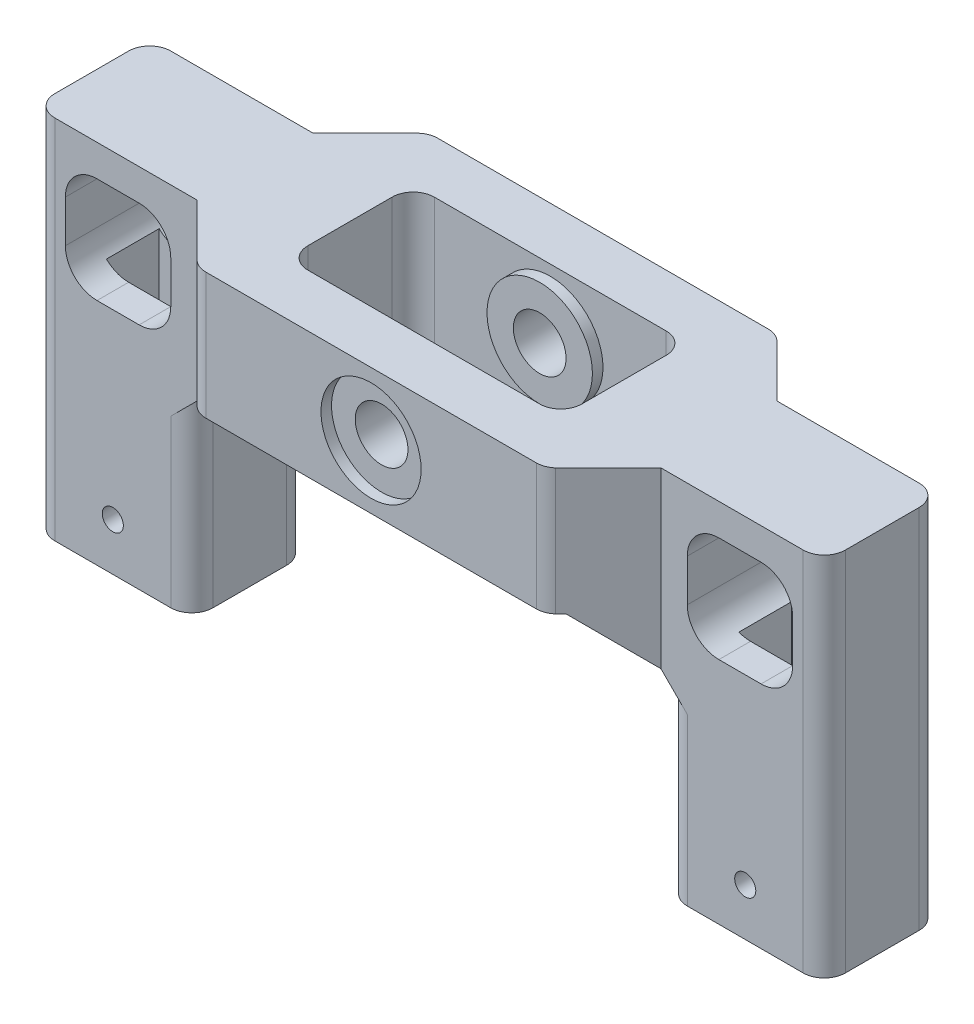
from build123d import *

# Parameters (mm, degrees)
EXTRUDE_1_DEPTH        = 5.5
EXTRUDE_1_DEPTH_BACK   = 5.5
SKETCH_1_W             = 15
SKETCH_1_H             = 24.5
EXTRUDE_1_2_DEPTH      = 5.5
EXTRUDE_1_2_DEPTH_BACK = 5.5
SKETCH_2_W             = 7.2
SKETCH_2_H             = 5
CUT_EXTRUDE_1_DEPTH    = 62
SKETCH_3_W             = 26
SKETCH_3_H             = 12
EXTRUDE_2_DEPTH        = 12
SKETCH_4_R             = 2.5
CUT_EXTRUDE_2_DEPTH    = 90
CHAMFER_2_SIZE         = 5
FILLET_2_R             = 2
SKETCH_14_W            = 15
SKETCH_14_H            = 11
SKETCH_14_W_2          = 7.2
SKETCH_14_H_2          = 5
EXTRUDE_5_DEPTH        = 10.25
SKETCH_7_R             = 1
CUT_EXTRUDE_3_DEPTH    = 34
EXTRUDE_START          = 1
SKETCH_13_R            = 5
SKETCH_13_R_2          = 2.5
EXTRUDE_4_DEPTH        = 1
CHAMFER_3_SIZE         = 5
SKETCH_19_W            = 10
SKETCH_19_H            = 10
CUT_EXTRUDE_4_DEPTH    = 31.2
SKETCH_17_R            = 4.75
SKETCH_17_R_2          = 2.5
CUT_EXTRUDE_5_DEPTH    = 1
SKETCH_20_W            = 7.2
SKETCH_20_H            = 3
EXTRUDE_6_DEPTH        = 5
FILLET_6_R             = 3
FILLET_7_R             = 2


with BuildPart() as part:
    # 草图1 → 凸台-拉伸1 (new, two sides: drawn at the far end of the back side and taken through both)
    with BuildSketch(Plane.XY.offset(-EXTRUDE_1_DEPTH_BACK)):
        with Locations((30, 0)):
            Rectangle(SKETCH_1_W, SKETCH_1_H)
    extrude(amount=EXTRUDE_1_DEPTH + EXTRUDE_1_DEPTH_BACK)


with BuildPart() as body_2:
    # 草图1 → Extrude 1 2 (new, two sides: drawn at the far end of the back side and taken through both)
    with BuildSketch(Plane.XY.offset(-EXTRUDE_1_2_DEPTH_BACK)):
        with Locations((-30, 0)):
            Rectangle(SKETCH_1_W, SKETCH_1_H)
    extrude(amount=EXTRUDE_1_2_DEPTH + EXTRUDE_1_2_DEPTH_BACK)


with BuildPart() as cut_extrude_1_tool:
    # 草图2 → 切除-拉伸1 (new body)
    with BuildSketch(Plane(origin=(0, 12.25, 0), x_dir=(1, 0, 0), z_dir=(0, 1, 0))):
        with Locations((30, 0)):
            Rectangle(SKETCH_2_W, SKETCH_2_H)
        with Locations((-30, 0)):
            Rectangle(SKETCH_2_W, SKETCH_2_H)
    extrude(amount=-CUT_EXTRUDE_1_DEPTH)


with BuildPart() as part_1:
    add(part.part)

    # 切除-拉伸1: cut by cut_extrude_1_tool
    add(cut_extrude_1_tool.part, mode=Mode.SUBTRACT)



with BuildPart() as body_2_1:
    add(body_2.part)

    # 切除-拉伸1: cut by cut_extrude_1_tool
    add(cut_extrude_1_tool.part, mode=Mode.SUBTRACT)


with BuildPart() as part_2:
    add(part_1.part)

    add(body_2_1.part)  # 凸台-拉伸2 merges body 2
    # 草图3 → 凸台-拉伸2 (add)
    with BuildSketch(Plane(origin=(0, 12.25, 0), x_dir=(1, 0, 0), z_dir=(0, 1, 0))):
        Polygon((22.5, 5.5), (17, 5.5), (17, 11), (-17, 11), (-17, 5.5), (-22.5, 5.5), (-22.5, -5.5), (-17, -5.5), (-17, -11), (17, -11), (17, -5.5), (22.5, -5.5), align=None)
        Rectangle(SKETCH_3_W, SKETCH_3_H, mode=Mode.SUBTRACT)
    extrude(amount=-EXTRUDE_2_DEPTH)

    # 草图4 → 切除-拉伸2 (cut)
    with BuildSketch(Plane.XY.offset(11)):
        with Locations((0, 6.25)):
            Circle(SKETCH_4_R)
    extrude(amount=-CUT_EXTRUDE_2_DEPTH, mode=Mode.SUBTRACT)

    # 倒角2
    chamfer_2_edges = [part_2.edges().sort_by_distance(p)[0] for p in [
        (17, 6.25, 5.5),
        (-17, 6.25, 5.5),
        (-17, 6.25, -5.5),
        (17, 6.25, -5.5),
    ]]
    chamfer(chamfer_2_edges, length=CHAMFER_2_SIZE)

    # 圆角2
    # the kernel refuses this fillet: 2 mm, written as the material it adds along each edge
    with BuildSketch(Plane(origin=(-13, 12.25, 6), x_dir=(0, 0, -1), z_dir=(0, -1, 0)), Plane(origin=(13, 12.25, 6), x_dir=(-1, 0, 0), z_dir=(0, -1, 0)), Plane(origin=(13, 12.25, -6), x_dir=(0, 0, 1), z_dir=(0, -1, 0))) as fillet_2_piece_1:
        with BuildLine():
            CenterArc((FILLET_2_R, FILLET_2_R), FILLET_2_R, 180, 90)
            Line((0, FILLET_2_R), (0, 0))
            Line((0, 0), (FILLET_2_R, 0))
        make_face()
    extrude(amount=12)
    with BuildSketch(Plane(origin=(-13, 12.25, -6), x_dir=(0, 0, 1), z_dir=(0, -1, 0))) as fillet_2_piece_2:
        with BuildLine():
            CenterArc((FILLET_2_R, -FILLET_2_R), FILLET_2_R, 90, 90)
            Line((0, -FILLET_2_R), (0, 0))
            Line((0, 0), (FILLET_2_R, 0))
        make_face()
    extrude(amount=12)
    # the kernel refuses this fillet: 2 mm, written as the material it takes off along each edge
    with BuildSketch(Plane(origin=(17, 15.557189139, 11), x_dir=(0, 0, -1), z_dir=(0, -1, 0))) as fillet_2_2_piece_1:
        with BuildLine():
            CenterArc((2, -1.322875656), FILLET_2_R, 138.590377891, 41.409622109)
            Line((0, -1.322875656), (0, 0))
            Line((0, 0), (0.5, 0))
        make_face()
    extrude(amount=18.614378278, mode=Mode.SUBTRACT)
    with BuildSketch(Plane(origin=(-17, 15.557189139, 11), x_dir=(1, 0, 0), z_dir=(0, -1, 0))) as fillet_2_2_piece_2:
        with BuildLine():
            CenterArc((1.322875656, -2), FILLET_2_R, 90, 41.409622109)
            Line((0, -0.5), (0, 0))
            Line((0, 0), (1.322875656, 0))
        make_face()
    extrude(amount=18.614378278, mode=Mode.SUBTRACT)
    with BuildSketch(Plane(origin=(-17, 15.557189139, -11), x_dir=(1, 0, 0), z_dir=(0, -1, 0))) as fillet_2_2_piece_3:
        with BuildLine():
            CenterArc((1.322875656, 2), FILLET_2_R, 228.590377891, 41.409622109)
            Line((0, 0.5), (0, 0))
            Line((0, 0), (1.322875656, 0))
        make_face()
    extrude(amount=18.614378278, mode=Mode.SUBTRACT)
    with BuildSketch(Plane(origin=(17, 15.557189139, -11), x_dir=(0, 0, 1), z_dir=(0, -1, 0))) as fillet_2_2_piece_4:
        with BuildLine():
            CenterArc((2, 1.322875656), FILLET_2_R, 180, 41.409622109)
            Line((0, 1.322875656), (0, 0))
            Line((0, 0), (0.5, 0))
        make_face()
    extrude(amount=18.614378278, mode=Mode.SUBTRACT)

    # 草图14 → 凸台-拉伸5 (add)
    # profile 1 of 2: a face of its own
    with BuildSketch(Plane.XZ.offset(12.25)):
        with Locations((-30, 0)):
            Rectangle(SKETCH_14_W, SKETCH_14_H)
        with Locations((-30, 0)):
            Rectangle(SKETCH_14_W_2, SKETCH_14_H_2, mode=Mode.SUBTRACT)
    # profile 2 of 2: a face of its own
    with BuildSketch(Plane.XZ.offset(12.25)):
        with Locations((30, 0)):
            Rectangle(SKETCH_14_W, SKETCH_14_H)
        with Locations((30, 0)):
            Rectangle(SKETCH_14_W_2, SKETCH_14_H_2, mode=Mode.SUBTRACT)
    extrude(amount=EXTRUDE_5_DEPTH)

    # 草图7 → 切除-拉伸3 (cut)
    with BuildSketch(Plane.XY.offset(5.5)):
        with Locations(Location((30, -18, 0), (0, 0, 180))):
            Circle(SKETCH_7_R)
        with Locations(Location((-30, -18, 0), (0, 0, 180))):
            Circle(SKETCH_7_R)
    extrude(amount=-CUT_EXTRUDE_3_DEPTH, mode=Mode.SUBTRACT)

    # 草图13 → 凸台-拉伸4 (add)
    with BuildSketch(Plane.XY.offset(-6).offset(EXTRUDE_START)):
        with Locations(Location((0, 6.25, 0), (0, 0, 180))):
            Circle(SKETCH_13_R)
        with Locations((0, 6.25)):
            Circle(SKETCH_13_R_2, mode=Mode.SUBTRACT)
    extrude_4 = extrude(amount=-EXTRUDE_4_DEPTH)

    # 镜向1: 凸台-拉伸4 across plane
    add(extrude_4.mirror(Plane.XY))

    # 倒角3
    chamfer_3_edges = [part_2.edges().sort_by_distance(p)[0] for p in [
        (22.5, 0.25, 0),
        (-22.5, 0.25, 0),
    ]]
    chamfer(chamfer_3_edges, length=CHAMFER_3_SIZE)

    # 草图19 → 切除-拉伸4 (cut)
    with BuildSketch(Plane.XY.offset(5.5)):
        with Locations((-29.5, 4.25)):
            Rectangle(SKETCH_19_W, SKETCH_19_H)
        with Locations((29.5, 4.25)):
            Rectangle(SKETCH_19_W, SKETCH_19_H)
    extrude(amount=-CUT_EXTRUDE_4_DEPTH, mode=Mode.SUBTRACT)

    # 草图17 → 切除-拉伸5 (cut)
    with BuildSketch(Plane.XY.offset(11)):
        with Locations((0, 6.25)):
            Circle(SKETCH_17_R)
        with Locations((0, 6.25)):
            Circle(SKETCH_17_R_2, mode=Mode.SUBTRACT)
    cut_extrude_5 = extrude(amount=-CUT_EXTRUDE_5_DEPTH, mode=Mode.SUBTRACT)

    # 镜向2: 切除-拉伸5 across plane
    add(cut_extrude_5.mirror(Plane.XY), mode=Mode.SUBTRACT)

    # 草图20 → 凸台-拉伸6 (add)
    with BuildSketch(Plane.XY.offset(-2.5)):
        with Locations((-30, 10.75)):
            Rectangle(SKETCH_20_W, SKETCH_20_H)
        with Locations((30, 10.75)):
            Rectangle(SKETCH_20_W, SKETCH_20_H)
    extrude(amount=EXTRUDE_6_DEPTH)

    # 圆角6
    # the kernel refuses this fillet: 3 mm, written as the material it adds along each edge
    with BuildSketch(Plane(origin=(24.5, -0.75, 5.5), x_dir=(0, 1, 0), z_dir=(0, 0, -1))) as fillet_6_piece_1_section:
        with BuildLine():
            CenterArc((FILLET_6_R, FILLET_6_R), FILLET_6_R, 180, 90)
            Line((0, FILLET_6_R), (0, 0))
            Line((0, 0), (FILLET_6_R, 0))
        make_face()
    fillet_6_piece_1 = extrude(amount=11, mode=Mode.PRIVATE)
    fillet_6_piece_1 = split(fillet_6_piece_1, bisect_by=Plane(origin=(24.5, -0.75, 2.5), z_dir=(0, 0, 1)), keep=Keep.TOP, mode=Mode.PRIVATE)
    fillet_6_piece_1 = split(fillet_6_piece_1, bisect_by=Plane(origin=(26.4, -0.75, 5.5), z_dir=(-1, 0, 0)), keep=Keep.TOP, mode=Mode.PRIVATE)
    add(fillet_6_piece_1)
    with BuildSketch(Plane(origin=(24.5, -0.75, 5.5), x_dir=(0, 1, 0), z_dir=(0, 0, -1))) as fillet_6_piece_2_section:
        with BuildLine():
            CenterArc((FILLET_6_R, FILLET_6_R), FILLET_6_R, 180, 90)
            Line((0, FILLET_6_R), (0, 0))
            Line((0, 0), (FILLET_6_R, 0))
        make_face()
    fillet_6_piece_2 = extrude(amount=11, mode=Mode.PRIVATE)
    fillet_6_piece_2 = split(fillet_6_piece_2, bisect_by=Plane(origin=(24.5, -0.75, 2.5), z_dir=(0, 0, 1)), keep=Keep.TOP, mode=Mode.PRIVATE)
    fillet_6_piece_2 = split(fillet_6_piece_2, bisect_by=Plane(origin=(26.4, -0.75, 5.5), z_dir=(1, 0, 0)), keep=Keep.TOP, mode=Mode.PRIVATE)
    add(fillet_6_piece_2)
    with BuildSketch(Plane(origin=(24.5, -0.75, 5.5), x_dir=(0, 1, 0), z_dir=(0, 0, -1))) as fillet_6_piece_3_section:
        with BuildLine():
            CenterArc((FILLET_6_R, FILLET_6_R), FILLET_6_R, 180, 90)
            Line((0, FILLET_6_R), (0, 0))
            Line((0, 0), (FILLET_6_R, 0))
        make_face()
    fillet_6_piece_3 = extrude(amount=11, mode=Mode.PRIVATE)
    fillet_6_piece_3 = split(fillet_6_piece_3, bisect_by=Plane(origin=(24.5, -0.75, -2.5), z_dir=(0, 0, 1)), keep=Keep.TOP, mode=Mode.PRIVATE)
    fillet_6_piece_3 = split(fillet_6_piece_3, bisect_by=Plane(origin=(24.5, -0.75, 2.5), z_dir=(0, 0, -1)), keep=Keep.TOP, mode=Mode.PRIVATE)
    fillet_6_piece_3 = split(fillet_6_piece_3, bisect_by=Plane(origin=(26.4, -0.75, 5.5), z_dir=(-1, 0, 0)), keep=Keep.TOP, mode=Mode.PRIVATE)
    add(fillet_6_piece_3)
    with BuildSketch(Plane(origin=(24.5, -0.75, 5.5), x_dir=(0, 1, 0), z_dir=(0, 0, -1))) as fillet_6_piece_4_section:
        with BuildLine():
            CenterArc((FILLET_6_R, FILLET_6_R), FILLET_6_R, 180, 90)
            Line((0, FILLET_6_R), (0, 0))
            Line((0, 0), (FILLET_6_R, 0))
        make_face()
    fillet_6_piece_4 = extrude(amount=11, mode=Mode.PRIVATE)
    fillet_6_piece_4 = split(fillet_6_piece_4, bisect_by=Plane(origin=(24.5, -0.75, -2.5), z_dir=(0, 0, -1)), keep=Keep.TOP, mode=Mode.PRIVATE)
    fillet_6_piece_4 = split(fillet_6_piece_4, bisect_by=Plane(origin=(26.4, -0.75, 5.5), z_dir=(-1, 0, 0)), keep=Keep.TOP, mode=Mode.PRIVATE)
    add(fillet_6_piece_4)
    with BuildSketch(Plane(origin=(24.5, -0.75, 5.5), x_dir=(0, 1, 0), z_dir=(0, 0, -1))) as fillet_6_piece_5_section:
        with BuildLine():
            CenterArc((FILLET_6_R, FILLET_6_R), FILLET_6_R, 180, 90)
            Line((0, FILLET_6_R), (0, 0))
            Line((0, 0), (FILLET_6_R, 0))
        make_face()
    fillet_6_piece_5 = extrude(amount=11, mode=Mode.PRIVATE)
    fillet_6_piece_5 = split(fillet_6_piece_5, bisect_by=Plane(origin=(24.5, -0.75, -2.5), z_dir=(0, 0, -1)), keep=Keep.TOP, mode=Mode.PRIVATE)
    fillet_6_piece_5 = split(fillet_6_piece_5, bisect_by=Plane(origin=(26.4, -0.75, 5.5), z_dir=(1, 0, 0)), keep=Keep.TOP, mode=Mode.PRIVATE)
    add(fillet_6_piece_5)
    with BuildSketch(Plane(origin=(-24.5, -0.75, 5.5), x_dir=(-1, 0, 0), z_dir=(0, 0, -1))) as fillet_6_piece_6_section:
        with BuildLine():
            CenterArc((FILLET_6_R, FILLET_6_R), FILLET_6_R, 180, 90)
            Line((0, FILLET_6_R), (0, 0))
            Line((0, 0), (FILLET_6_R, 0))
        make_face()
    fillet_6_piece_6 = extrude(amount=11, mode=Mode.PRIVATE)
    fillet_6_piece_6 = split(fillet_6_piece_6, bisect_by=Plane(origin=(-24.5, -0.75, 2.5), z_dir=(0, 0, 1)), keep=Keep.TOP, mode=Mode.PRIVATE)
    fillet_6_piece_6 = split(fillet_6_piece_6, bisect_by=Plane(origin=(-26.4, -0.75, 5.5), z_dir=(-1, 0, 0)), keep=Keep.TOP, mode=Mode.PRIVATE)
    add(fillet_6_piece_6)
    with BuildSketch(Plane(origin=(-24.5, -0.75, 5.5), x_dir=(-1, 0, 0), z_dir=(0, 0, -1))) as fillet_6_piece_7_section:
        with BuildLine():
            CenterArc((FILLET_6_R, FILLET_6_R), FILLET_6_R, 180, 90)
            Line((0, FILLET_6_R), (0, 0))
            Line((0, 0), (FILLET_6_R, 0))
        make_face()
    fillet_6_piece_7 = extrude(amount=11, mode=Mode.PRIVATE)
    fillet_6_piece_7 = split(fillet_6_piece_7, bisect_by=Plane(origin=(-24.5, -0.75, 2.5), z_dir=(0, 0, 1)), keep=Keep.TOP, mode=Mode.PRIVATE)
    fillet_6_piece_7 = split(fillet_6_piece_7, bisect_by=Plane(origin=(-26.4, -0.75, 5.5), z_dir=(1, 0, 0)), keep=Keep.TOP, mode=Mode.PRIVATE)
    add(fillet_6_piece_7)
    with BuildSketch(Plane(origin=(-24.5, -0.75, 5.5), x_dir=(-1, 0, 0), z_dir=(0, 0, -1))) as fillet_6_piece_8_section:
        with BuildLine():
            CenterArc((FILLET_6_R, FILLET_6_R), FILLET_6_R, 180, 90)
            Line((0, FILLET_6_R), (0, 0))
            Line((0, 0), (FILLET_6_R, 0))
        make_face()
    fillet_6_piece_8 = extrude(amount=11, mode=Mode.PRIVATE)
    fillet_6_piece_8 = split(fillet_6_piece_8, bisect_by=Plane(origin=(-24.5, -0.75, 2.5), z_dir=(0, 0, -1)), keep=Keep.TOP, mode=Mode.PRIVATE)
    fillet_6_piece_8 = split(fillet_6_piece_8, bisect_by=Plane(origin=(-24.5, -0.75, -2.5), z_dir=(0, 0, 1)), keep=Keep.TOP, mode=Mode.PRIVATE)
    fillet_6_piece_8 = split(fillet_6_piece_8, bisect_by=Plane(origin=(-26.4, -0.75, 5.5), z_dir=(1, 0, 0)), keep=Keep.TOP, mode=Mode.PRIVATE)
    add(fillet_6_piece_8)
    with BuildSketch(Plane(origin=(-24.5, -0.75, 5.5), x_dir=(-1, 0, 0), z_dir=(0, 0, -1))) as fillet_6_piece_9_section:
        with BuildLine():
            CenterArc((FILLET_6_R, FILLET_6_R), FILLET_6_R, 180, 90)
            Line((0, FILLET_6_R), (0, 0))
            Line((0, 0), (FILLET_6_R, 0))
        make_face()
    fillet_6_piece_9 = extrude(amount=11, mode=Mode.PRIVATE)
    fillet_6_piece_9 = split(fillet_6_piece_9, bisect_by=Plane(origin=(-24.5, -0.75, -2.5), z_dir=(0, 0, -1)), keep=Keep.TOP, mode=Mode.PRIVATE)
    fillet_6_piece_9 = split(fillet_6_piece_9, bisect_by=Plane(origin=(-26.4, -0.75, 5.5), z_dir=(-1, 0, 0)), keep=Keep.TOP, mode=Mode.PRIVATE)
    add(fillet_6_piece_9)
    with BuildSketch(Plane(origin=(-24.5, -0.75, 5.5), x_dir=(-1, 0, 0), z_dir=(0, 0, -1))) as fillet_6_piece_10_section:
        with BuildLine():
            CenterArc((FILLET_6_R, FILLET_6_R), FILLET_6_R, 180, 90)
            Line((0, FILLET_6_R), (0, 0))
            Line((0, 0), (FILLET_6_R, 0))
        make_face()
    fillet_6_piece_10 = extrude(amount=11, mode=Mode.PRIVATE)
    fillet_6_piece_10 = split(fillet_6_piece_10, bisect_by=Plane(origin=(-24.5, -0.75, -2.5), z_dir=(0, 0, -1)), keep=Keep.TOP, mode=Mode.PRIVATE)
    fillet_6_piece_10 = split(fillet_6_piece_10, bisect_by=Plane(origin=(-26.4, -0.75, 5.5), z_dir=(1, 0, 0)), keep=Keep.TOP, mode=Mode.PRIVATE)
    add(fillet_6_piece_10)
    with BuildSketch(Plane(origin=(34.5, -0.75, 5.5), x_dir=(-1, 0, 0), z_dir=(0, 0, -1))) as fillet_6_piece_11_section:
        with BuildLine():
            CenterArc((FILLET_6_R, FILLET_6_R), FILLET_6_R, 180, 90)
            Line((0, FILLET_6_R), (0, 0))
            Line((0, 0), (FILLET_6_R, 0))
        make_face()
    fillet_6_piece_11 = extrude(amount=11, mode=Mode.PRIVATE)
    fillet_6_piece_11 = split(fillet_6_piece_11, bisect_by=Plane(origin=(33.6, -0.75, 5.5), z_dir=(-1, 0, 0)), keep=Keep.TOP, mode=Mode.PRIVATE)
    fillet_6_piece_11 = split(fillet_6_piece_11, bisect_by=Plane(origin=(34.5, -0.75, 2.5), z_dir=(0, 0, 1)), keep=Keep.TOP, mode=Mode.PRIVATE)
    add(fillet_6_piece_11)
    with BuildSketch(Plane(origin=(34.5, -0.75, 5.5), x_dir=(-1, 0, 0), z_dir=(0, 0, -1))) as fillet_6_piece_12_section:
        with BuildLine():
            CenterArc((FILLET_6_R, FILLET_6_R), FILLET_6_R, 180, 90)
            Line((0, FILLET_6_R), (0, 0))
            Line((0, 0), (FILLET_6_R, 0))
        make_face()
    fillet_6_piece_12 = extrude(amount=11, mode=Mode.PRIVATE)
    fillet_6_piece_12 = split(fillet_6_piece_12, bisect_by=Plane(origin=(33.6, -0.75, 5.5), z_dir=(1, 0, 0)), keep=Keep.TOP, mode=Mode.PRIVATE)
    fillet_6_piece_12 = split(fillet_6_piece_12, bisect_by=Plane(origin=(34.5, -0.75, 2.5), z_dir=(0, 0, 1)), keep=Keep.TOP, mode=Mode.PRIVATE)
    add(fillet_6_piece_12)
    with BuildSketch(Plane(origin=(34.5, -0.75, 5.5), x_dir=(-1, 0, 0), z_dir=(0, 0, -1))) as fillet_6_piece_13_section:
        with BuildLine():
            CenterArc((FILLET_6_R, FILLET_6_R), FILLET_6_R, 180, 90)
            Line((0, FILLET_6_R), (0, 0))
            Line((0, 0), (FILLET_6_R, 0))
        make_face()
    fillet_6_piece_13 = extrude(amount=11, mode=Mode.PRIVATE)
    fillet_6_piece_13 = split(fillet_6_piece_13, bisect_by=Plane(origin=(34.5, -0.75, -2.5), z_dir=(0, 0, 1)), keep=Keep.TOP, mode=Mode.PRIVATE)
    fillet_6_piece_13 = split(fillet_6_piece_13, bisect_by=Plane(origin=(33.6, -0.75, 5.5), z_dir=(1, 0, 0)), keep=Keep.TOP, mode=Mode.PRIVATE)
    fillet_6_piece_13 = split(fillet_6_piece_13, bisect_by=Plane(origin=(34.5, -0.75, 2.5), z_dir=(0, 0, -1)), keep=Keep.TOP, mode=Mode.PRIVATE)
    add(fillet_6_piece_13)
    with BuildSketch(Plane(origin=(34.5, -0.75, 5.5), x_dir=(-1, 0, 0), z_dir=(0, 0, -1))) as fillet_6_piece_14_section:
        with BuildLine():
            CenterArc((FILLET_6_R, FILLET_6_R), FILLET_6_R, 180, 90)
            Line((0, FILLET_6_R), (0, 0))
            Line((0, 0), (FILLET_6_R, 0))
        make_face()
    fillet_6_piece_14 = extrude(amount=11, mode=Mode.PRIVATE)
    fillet_6_piece_14 = split(fillet_6_piece_14, bisect_by=Plane(origin=(34.5, -0.75, -2.5), z_dir=(0, 0, -1)), keep=Keep.TOP, mode=Mode.PRIVATE)
    fillet_6_piece_14 = split(fillet_6_piece_14, bisect_by=Plane(origin=(33.6, -0.75, 5.5), z_dir=(-1, 0, 0)), keep=Keep.TOP, mode=Mode.PRIVATE)
    add(fillet_6_piece_14)
    with BuildSketch(Plane(origin=(34.5, -0.75, 5.5), x_dir=(-1, 0, 0), z_dir=(0, 0, -1))) as fillet_6_piece_15_section:
        with BuildLine():
            CenterArc((FILLET_6_R, FILLET_6_R), FILLET_6_R, 180, 90)
            Line((0, FILLET_6_R), (0, 0))
            Line((0, 0), (FILLET_6_R, 0))
        make_face()
    fillet_6_piece_15 = extrude(amount=11, mode=Mode.PRIVATE)
    fillet_6_piece_15 = split(fillet_6_piece_15, bisect_by=Plane(origin=(34.5, -0.75, -2.5), z_dir=(0, 0, -1)), keep=Keep.TOP, mode=Mode.PRIVATE)
    fillet_6_piece_15 = split(fillet_6_piece_15, bisect_by=Plane(origin=(33.6, -0.75, 5.5), z_dir=(1, 0, 0)), keep=Keep.TOP, mode=Mode.PRIVATE)
    add(fillet_6_piece_15)
    with BuildSketch(Plane(origin=(24.5, 9.25, 5.5), x_dir=(1, 0, 0), z_dir=(0, 0, -1)), Plane(origin=(-24.5, 9.25, 5.5), x_dir=(0, -1, 0), z_dir=(0, 0, -1)), Plane(origin=(-34.5, 9.25, 5.5), x_dir=(1, 0, 0), z_dir=(0, 0, -1))) as fillet_6_piece_16:
        with BuildLine():
            CenterArc((FILLET_6_R, FILLET_6_R), FILLET_6_R, 180, 90)
            Line((0, FILLET_6_R), (0, 0))
            Line((0, 0), (FILLET_6_R, 0))
        make_face()
    extrude(amount=11)
    with BuildSketch(Plane(origin=(34.5, 9.25, 5.5), x_dir=(-1, 0, 0), z_dir=(0, 0, -1))) as fillet_6_piece_17:
        with BuildLine():
            CenterArc((FILLET_6_R, -FILLET_6_R), FILLET_6_R, 90, 90)
            Line((0, -FILLET_6_R), (0, 0))
            Line((0, 0), (FILLET_6_R, 0))
        make_face()
    extrude(amount=11)
    with BuildSketch(Plane(origin=(-34.5, -0.75, 5.5), x_dir=(1, 0, 0), z_dir=(0, 0, -1))) as fillet_6_piece_18_section:
        with BuildLine():
            CenterArc((FILLET_6_R, -FILLET_6_R), FILLET_6_R, 90, 90)
            Line((0, -FILLET_6_R), (0, 0))
            Line((0, 0), (FILLET_6_R, 0))
        make_face()
    fillet_6_piece_18 = extrude(amount=11, mode=Mode.PRIVATE)
    fillet_6_piece_18 = split(fillet_6_piece_18, bisect_by=Plane(origin=(-34.5, -0.75, 2.5), z_dir=(0, 0, 1)), keep=Keep.TOP, mode=Mode.PRIVATE)
    fillet_6_piece_18 = split(fillet_6_piece_18, bisect_by=Plane(origin=(-33.6, -0.75, 5.5), z_dir=(1, 0, 0)), keep=Keep.TOP, mode=Mode.PRIVATE)
    add(fillet_6_piece_18)
    with BuildSketch(Plane(origin=(-34.5, -0.75, 5.5), x_dir=(1, 0, 0), z_dir=(0, 0, -1))) as fillet_6_piece_19_section:
        with BuildLine():
            CenterArc((FILLET_6_R, -FILLET_6_R), FILLET_6_R, 90, 90)
            Line((0, -FILLET_6_R), (0, 0))
            Line((0, 0), (FILLET_6_R, 0))
        make_face()
    fillet_6_piece_19 = extrude(amount=11, mode=Mode.PRIVATE)
    fillet_6_piece_19 = split(fillet_6_piece_19, bisect_by=Plane(origin=(-34.5, -0.75, 2.5), z_dir=(0, 0, 1)), keep=Keep.TOP, mode=Mode.PRIVATE)
    fillet_6_piece_19 = split(fillet_6_piece_19, bisect_by=Plane(origin=(-33.6, -0.75, 5.5), z_dir=(-1, 0, 0)), keep=Keep.TOP, mode=Mode.PRIVATE)
    add(fillet_6_piece_19)
    with BuildSketch(Plane(origin=(-34.5, -0.75, 5.5), x_dir=(1, 0, 0), z_dir=(0, 0, -1))) as fillet_6_piece_20_section:
        with BuildLine():
            CenterArc((FILLET_6_R, -FILLET_6_R), FILLET_6_R, 90, 90)
            Line((0, -FILLET_6_R), (0, 0))
            Line((0, 0), (FILLET_6_R, 0))
        make_face()
    fillet_6_piece_20 = extrude(amount=11, mode=Mode.PRIVATE)
    fillet_6_piece_20 = split(fillet_6_piece_20, bisect_by=Plane(origin=(-34.5, -0.75, 2.5), z_dir=(0, 0, -1)), keep=Keep.TOP, mode=Mode.PRIVATE)
    fillet_6_piece_20 = split(fillet_6_piece_20, bisect_by=Plane(origin=(-33.6, -0.75, 5.5), z_dir=(-1, 0, 0)), keep=Keep.TOP, mode=Mode.PRIVATE)
    fillet_6_piece_20 = split(fillet_6_piece_20, bisect_by=Plane(origin=(-34.5, -0.75, -2.5), z_dir=(0, 0, 1)), keep=Keep.TOP, mode=Mode.PRIVATE)
    add(fillet_6_piece_20)
    with BuildSketch(Plane(origin=(-34.5, -0.75, 5.5), x_dir=(1, 0, 0), z_dir=(0, 0, -1))) as fillet_6_piece_21_section:
        with BuildLine():
            CenterArc((FILLET_6_R, -FILLET_6_R), FILLET_6_R, 90, 90)
            Line((0, -FILLET_6_R), (0, 0))
            Line((0, 0), (FILLET_6_R, 0))
        make_face()
    fillet_6_piece_21 = extrude(amount=11, mode=Mode.PRIVATE)
    fillet_6_piece_21 = split(fillet_6_piece_21, bisect_by=Plane(origin=(-33.6, -0.75, 5.5), z_dir=(1, 0, 0)), keep=Keep.TOP, mode=Mode.PRIVATE)
    fillet_6_piece_21 = split(fillet_6_piece_21, bisect_by=Plane(origin=(-34.5, -0.75, -2.5), z_dir=(0, 0, -1)), keep=Keep.TOP, mode=Mode.PRIVATE)
    add(fillet_6_piece_21)
    with BuildSketch(Plane(origin=(-34.5, -0.75, 5.5), x_dir=(1, 0, 0), z_dir=(0, 0, -1))) as fillet_6_piece_22_section:
        with BuildLine():
            CenterArc((FILLET_6_R, -FILLET_6_R), FILLET_6_R, 90, 90)
            Line((0, -FILLET_6_R), (0, 0))
            Line((0, 0), (FILLET_6_R, 0))
        make_face()
    fillet_6_piece_22 = extrude(amount=11, mode=Mode.PRIVATE)
    fillet_6_piece_22 = split(fillet_6_piece_22, bisect_by=Plane(origin=(-33.6, -0.75, 5.5), z_dir=(-1, 0, 0)), keep=Keep.TOP, mode=Mode.PRIVATE)
    fillet_6_piece_22 = split(fillet_6_piece_22, bisect_by=Plane(origin=(-34.5, -0.75, -2.5), z_dir=(0, 0, -1)), keep=Keep.TOP, mode=Mode.PRIVATE)
    add(fillet_6_piece_22)

    # 圆角7
    fillet_7_edges = [part_2.edges().sort_by_distance(p)[0] for p in [
        (-37.5, -5.125, -5.5),
        (-22.5, -13.625, 5.5),
        (-37.5, -5.125, 5.5),
        (37.5, -5.125, 5.5),
        (22.5, -13.625, 5.5),
        (22.5, -13.625, -5.5),
        (37.5, -5.125, -5.5),
        (-22.5, -13.625, -5.5),
    ]]
    fillet(fillet_7_edges, radius=FILLET_7_R)


solid = part_2.part
